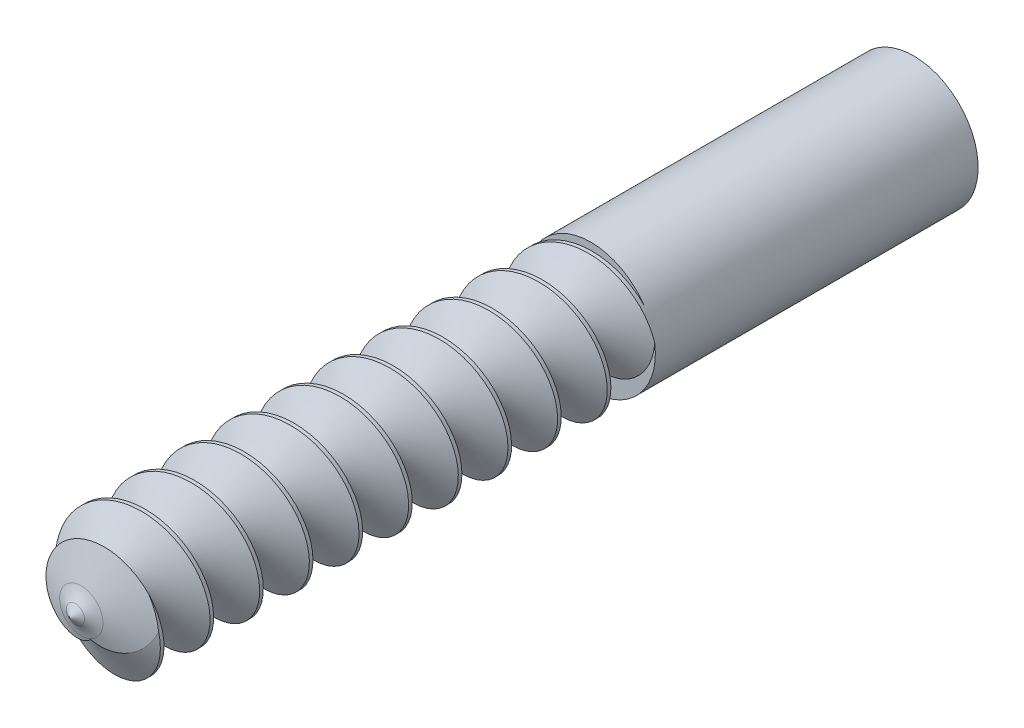
from build123d import *
from build123d.topology import SkipClean

# Parameters (mm, degrees)
SKETCH2_R                = 6.5
BOSS_EXTRUDE1_DEPTH      = 55
CUT_SWEEP1_PITCH         = 5
BOSS_EXTRUDE2_DEPTH      = 30
BOSS_EXTRUDE2_DEPTH_BACK = 2.5
SKETCH7_R                = 6.5


with BuildPart() as part:
    # Sketch2 → Boss-Extrude1 (new body)
    with BuildSketch(Plane.XY):
        Circle(SKETCH2_R)
    extrude(amount=BOSS_EXTRUDE1_DEPTH)

    # Cut-Sweep1: the profile of Sketch5 screwed along a right-hand helix of 14 turns, 12 arcs to a turn; built about Z, then put on its axis
    cut_sweep1_z = Axis((0, 0, 0), (0, 0, 1))
    cut_sweep1_corners = [(6.537713099, -0.317669725, 2.594771075), (6.537713099, 0.247396312, -2.020767937), (2.249884444, -0.035136706, 0.287001569)]
    with BuildLine(mode=Mode.PRIVATE) as cut_sweep1_profile:
        Line(cut_sweep1_corners[0], cut_sweep1_corners[1])
        Line(cut_sweep1_corners[1], cut_sweep1_corners[2])
        Line(cut_sweep1_corners[2], cut_sweep1_corners[0])
    cut_sweep1_cap = Face(cut_sweep1_profile.wire())
    cut_sweep1_turn_angles = [0, 15, 30, 45, 60, 75, 90, 105, 120, 135, 150, 165, 180, 195, 210, 225, 240, 255, 270, 285, 300, 315, 330, 345, 360]
    cut_sweep1_turn_weights = [1, 0.9659258262890683, 1, 0.9659258262890683, 1, 0.9659258262890683, 1, 0.9659258262890683, 1, 0.9659258262890683, 1, 0.9659258262890683, 1, 0.9659258262890683, 1, 0.9659258262890683, 1, 0.9659258262890683, 1, 0.9659258262890683, 1, 0.9659258262890683, 1, 0.9659258262890683, 1]
    cut_sweep1_turn_rails = [Edge.make_bspline([Vector(p[0], p[1], 0).rotate(cut_sweep1_z, cut_sweep1_turn_angles[k]) / cut_sweep1_turn_weights[k] + Vector(0, 0, p[2] + CUT_SWEEP1_PITCH * cut_sweep1_turn_angles[k] / 360) for k in range(25)], [0, 0, 0, 1, 1, 2, 2, 3, 3, 4, 4, 5, 5, 6, 6, 7, 7, 8, 8, 9, 9, 10, 10, 11, 11, 12, 12, 12], 2, cut_sweep1_turn_weights) for p in cut_sweep1_corners]
    cut_sweep1_turn_sides = [Face.make_surface_from_curves(cut_sweep1_turn_rails[p[0]], cut_sweep1_turn_rails[p[1]]) for p in [(0, 1), (1, 2), (2, 0)]]
    cut_sweep1 = Plane(origin=(0, 0, 60), x_dir=(1, 0, 0), z_dir=(0, 0, -1)) * Solid(Shell([*[p.moved(Location((0, 0, CUT_SWEEP1_PITCH * i))) for i in range(14) for p in cut_sweep1_turn_sides], cut_sweep1_cap, cut_sweep1_cap.rotate(cut_sweep1_z, 5040).moved(Location((0, 0, CUT_SWEEP1_PITCH * 5040 / 360)))]))
    add(cut_sweep1, mode=Mode.SUBTRACT)

    # Sketch7 → Boss-Extrude2 (add, two sides: drawn at the far end of the back side and taken through both)
    with SkipClean():  # the faces are left unmerged after this step: merging them gives an invalid solid
        with BuildSketch(Plane(origin=(0, 0, 0), x_dir=(-1, 0, 0), z_dir=(0, 0, -1)).offset(-BOSS_EXTRUDE2_DEPTH_BACK)):
            Circle(SKETCH7_R)
        extrude(amount=BOSS_EXTRUDE2_DEPTH + BOSS_EXTRUDE2_DEPTH_BACK)

    # Sketch10 → Cut-Revolve3 (revolve, cut)
    with SkipClean():  # the faces are left unmerged after this step: merging them gives an invalid solid
        with BuildSketch(Plane(origin=(0, 0, 0), x_dir=(1, 0, 0), z_dir=(0, 1, 0))):
            with BuildLine():
                Line((-7.65165082, -52.126184735), (-7.65165082, -60.676847384))
                Line((-7.65165082, -60.676847384), (0, -60.676847384))
                Line((0, -60.676847384), (0, -55))
                Line((0, -55), (-0.921001532, -54.399527269))
                ThreePointArc((-0.921001532, -54.399527269), (-1.530635496, -54.060173561), (-2.181573318, -53.808987454))
                Line((-2.181573318, -53.808987454), (-7.65165082, -52.126184735))
            make_face()
        revolve(axis=Axis((0, 0, 60.676847384), (0, 0, -1)), mode=Mode.SUBTRACT)


solid = part.part
